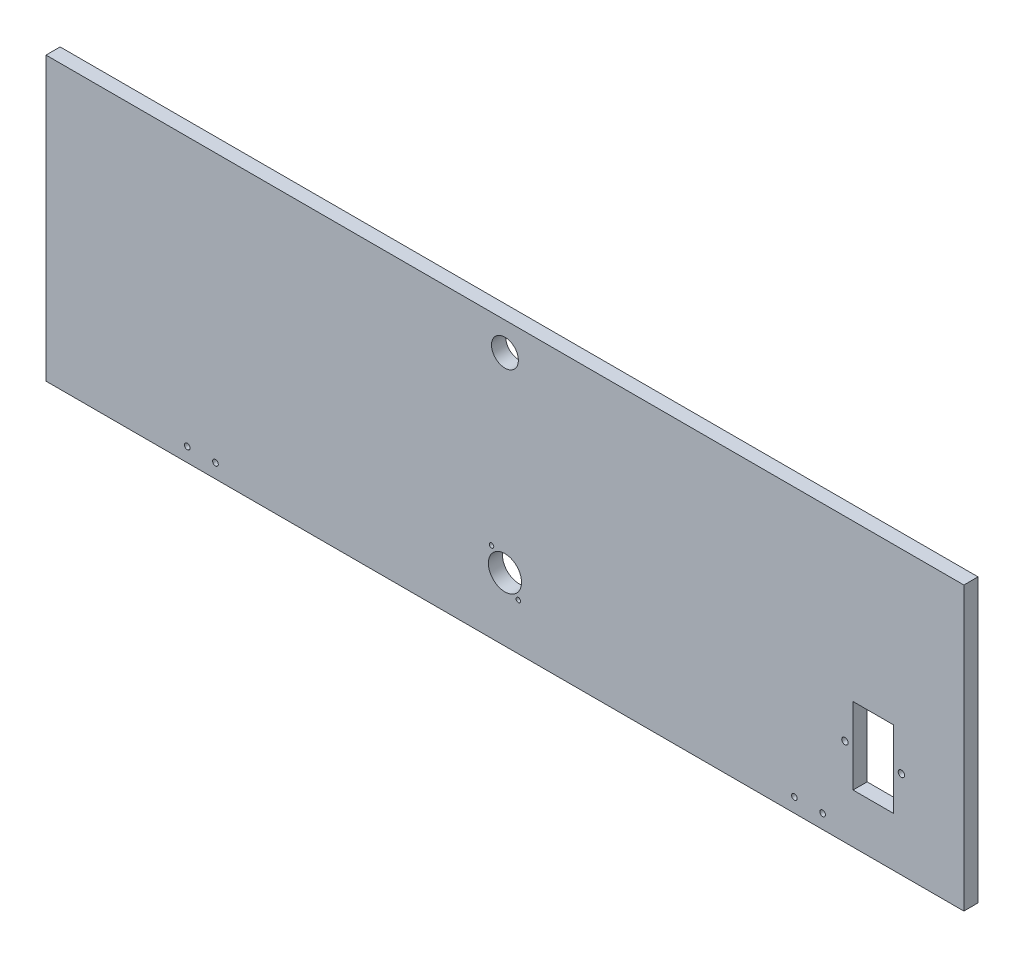
from build123d import *

# Parameters (mm, degrees)
ESQUISSE1_W             = 650
ESQUISSE1_H             = 200
BOSS_EXTRU_1_DEPTH      = 10
ESQUISSE2_R             = 2
ENL_V_MAT_EXTRU_1_DEPTH = 10
ESQUISSE3_R             = 1.6
ESQUISSE3_R_2           = 11.75
ESQUISSE3_W             = 28.5
ESQUISSE3_H             = 54.3
ESQUISSE3_R_3           = 2.25
ENL_V_MAT_EXTRU_2_DEPTH = 10
ESQUISSE4_R             = 9.5
ENL_V_MAT_EXTRU_3_DEPTH = 10
ESQUISSE5_R             = 1.5
ENL_V_MAT_EXTRU_4_DEPTH = 2


with BuildPart() as part:
    # Esquisse1 → Boss.-Extru.1 (new body)
    with BuildSketch(Plane.XY):
        with Locations((325, 100)):
            Rectangle(ESQUISSE1_W, ESQUISSE1_H)
    extrude(amount=BOSS_EXTRU_1_DEPTH)

    # Esquisse2 → Enlèv. mat.-Extru.1 (cut)
    with BuildSketch(Plane.XY.offset(10)):
        with Locations((100, 10)):
            Circle(ESQUISSE2_R)
        with Locations((120, 10)):
            Circle(ESQUISSE2_R)
        with Locations((530, 10)):
            Circle(ESQUISSE2_R)
        with Locations((550, 10)):
            Circle(ESQUISSE2_R)
    extrude(amount=-ENL_V_MAT_EXTRU_1_DEPTH, mode=Mode.SUBTRACT)

    # Esquisse3 → Enlèv. mat.-Extru.2 (cut)
    with BuildSketch(Plane.XY.offset(10)):
        with Locations((315.499614794, 56.999404399)):
            Circle(ESQUISSE3_R)
        with Locations((325, 45)):
            Circle(ESQUISSE3_R_2)
        with Locations((334.500385206, 33.000595601)):
            Circle(ESQUISSE3_R)
        with Locations((585.75, 62.15)):
            Rectangle(ESQUISSE3_W, ESQUISSE3_H)
        with Locations((565.75, 62.15)):
            Circle(ESQUISSE3_R_3)
        with Locations((605.75, 62.15)):
            Circle(ESQUISSE3_R_3)
    extrude(amount=-ENL_V_MAT_EXTRU_2_DEPTH, mode=Mode.SUBTRACT)

    # Esquisse4 → Enlèv. mat.-Extru.3 (cut)
    with BuildSketch(Plane.XY.offset(10)):
        with Locations((325, 180)):
            Circle(ESQUISSE4_R)
    extrude(amount=-ENL_V_MAT_EXTRU_3_DEPTH, mode=Mode.SUBTRACT)

    # Esquisse5 → Enlèv. mat.-Extru.4 (cut)
    with BuildSketch(Plane.XY):
        with Locations((341, 180)):
            Circle(ESQUISSE5_R)
        with Locations((309, 180)):
            Circle(ESQUISSE5_R)
    extrude(amount=ENL_V_MAT_EXTRU_4_DEPTH, mode=Mode.SUBTRACT)


solid = part.part
